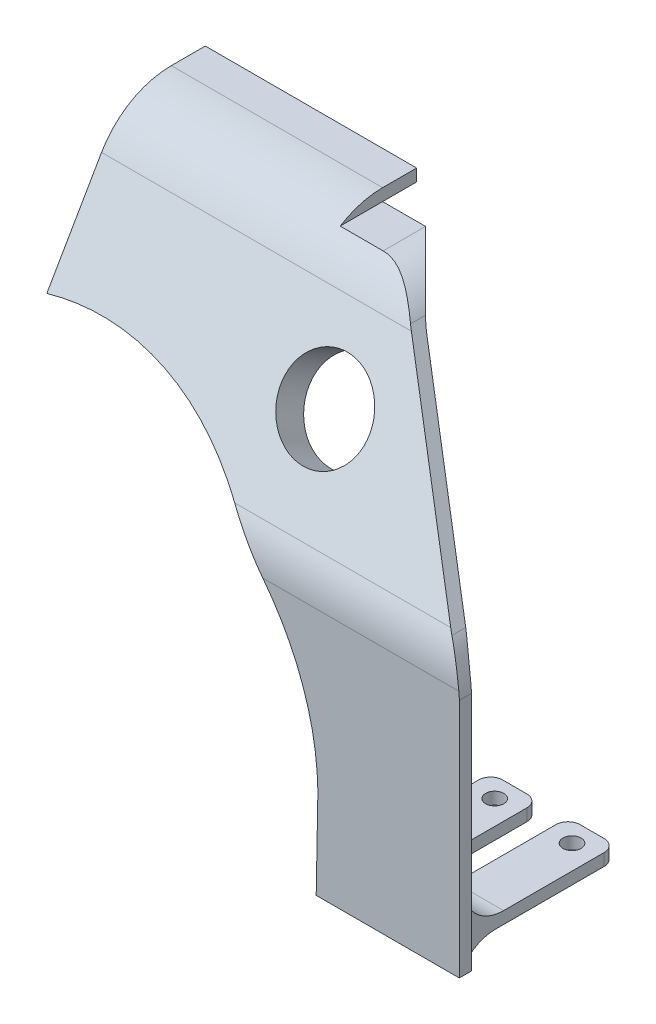
from build123d import *

# Parameters (mm, degrees)
SALIENTE_EXTRUIR1_DEPTH  = 58.05
REDONDEO1_R              = 20
REDONDEO2_R              = 20
REDONDEO3_R              = 17
REDONDEO4_R              = 17
CAVIDAD1_START           = -47
CAVIDAD1_DEPTH           = 51
CROQUIS8_W               = 12
CROQUIS8_H               = 3
SALIENTE_EXTRUIR2_DEPTH  = 38
CROQUIS9_R               = 2.25
CORTAR_EXTRUIR6_DEPTH    = 135.588949923
SALIENTE_EXTRUIR3_REACH  = 146.947
CROQUIS11_W              = 20
CROQUIS11_H              = 3
CROQUIS12_W              = 69.238292886
CROQUIS12_H              = 3
CORTAR_EXTRUIR7_DEPTH    = 1
CROQUIS15_R              = 1.75
CORTAR_EXTRUIR10_DEPTH   = 5
REDONDEO5_R              = 7
REDONDEO6_R              = 3
CROQUIS18_R              = 11
CORTAR_EXTRUIR12_DEPTH   = 146.081609054
CROQUIS19_R              = 13.25
CROQUIS19_R_2            = 11
SALIENTE_EXTRUIR4_DEPTH  = 5
CROQUIS16_R              = 65
CORTAR_EXTRUIR11_DEPTH   = 145.946782753
SALIENTE_EXTRUIR5_DEPTH  = 3
NERVIO8_START            = -1.125
NERVIO8_DEPTH            = 2.25
MATRIZC2_COUNT           = 6
REDONDEO6_OF_SIMETR_A1_R = 3
REDONDEO7_R              = 10
REDONDEO8_R              = 10
REDONDEO9_R              = 6
CORTAR_EXTRUIR14_DEPTH   = 145.946782753
REDONDEO10_R             = 5


with BuildPart() as part:
    # Croquis1 → Saliente-Extruir1 (new, symmetric)
    with BuildSketch(Plane(origin=(0, 0, 0), x_dir=(0, 0, -1), z_dir=(1, 0, 0))):
        Polygon((0, 0), (0, 67.196152423), (28.732050808, 116.961524227), (47, 116.961524227), (47, 119.961524227), (27, 119.961524227), (-3, 68), (-3, 0), align=None)
    extrude(amount=SALIENTE_EXTRUIR1_DEPTH, both=True)

    # Redondeo1
    redondeo1_edges = [part.edges().sort_by_distance(p)[0] for p in [
        (0, 68, 3),
    ]]
    fillet(redondeo1_edges, radius=REDONDEO1_R)

    # Redondeo2
    redondeo2_edges = [part.edges().sort_by_distance(p)[0] for p in [
        (0, 119.961524227, -27),
    ]]
    fillet(redondeo2_edges, radius=REDONDEO2_R)

    # Redondeo3
    redondeo3_edges = [part.edges().sort_by_distance(p)[0] for p in [
        (0, 116.961524227, -28.732050808),
    ]]
    fillet(redondeo3_edges, radius=REDONDEO3_R)

    # Redondeo4
    redondeo4_edges = [part.edges().sort_by_distance(p)[0] for p in [
        (0, 67.196152423, 0),
    ]]
    fillet(redondeo4_edges, radius=REDONDEO4_R)

    # Cavidad1: read off the stored shape, not the designer's step
    # Cavidad1 outline → Cavidad1 (cut)
    with BuildSketch(Plane.XY.offset(CAVIDAD1_START)):
        with BuildLine():
            Line((58.05, 0), (58.05, 119.961524227))
            Line((58.05, 119.961524227), (-5.55, 119.961524227))
            Line((-5.55, 119.961524227), (-5.55, 116.961524227))
            Line((-5.55, 116.961524227), (5.123846837, 116.961524227))
            ThreePointArc((5.123846837, 116.961524227), (12.308357287, 115.368756607), (18.14660237, 110.888913592))
            Line((18.14660237, 110.888913592), (51.073651347, 71.647984679))
            ThreePointArc((51.073651347, 71.647984679), (54.025670368, 66.534937751), (55.050895814, 60.720595315))
            Line((55.050895814, 60.720595315), (55.050895814, 0))
            Line((55.050895814, 0), (58.05, 0))
        make_face()
    extrude(amount=CAVIDAD1_DEPTH, mode=Mode.SUBTRACT)

    # Croquis8 → Saliente-Extruir2 (add)
    with BuildSketch(Plane(origin=(0, 0, 0), x_dir=(-1, 0, 0), z_dir=(0, 0, -1))):
        with Locations((-47.050895814, 6.5)):
            Rectangle(CROQUIS8_W, CROQUIS8_H)
    saliente_extruir2 = extrude(amount=SALIENTE_EXTRUIR2_DEPTH)

    # Croquis9 → Cortar-Extruir6 (cut, through all)
    with BuildSketch(Plane(origin=(0, 8, 0), x_dir=(1, 0, 0), z_dir=(0, 1, 0))):
        with Locations(Location((47.050895814, 33, 0), (0, 0, 180))):
            Circle(CROQUIS9_R)
    cortar_extruir6 = extrude(amount=-CORTAR_EXTRUIR6_DEPTH, mode=Mode.SUBTRACT)

    # Saliente-Extruir3: up to this plane
    saliente_extruir3_end = Plane(origin=(58.05, 67.196152423, 0), z_dir=(0, 0.49999999999999767, 0.86602540378444))
    # Croquis11 → Saliente-Extruir3 (add, up to the surface)
    with BuildSketch(Plane(origin=(0, 0, -54), x_dir=(-1, 0, 0), z_dir=(0, 0, -1)), mode=Mode.PRIVATE) as saliente_extruir3_sk1:
        with Locations((28.05, 92.461524227)):
            Rectangle(CROQUIS11_W, CROQUIS11_H)
    saliente_extruir3_tool1 = split(extrude(saliente_extruir3_sk1.sketch, amount=-SALIENTE_EXTRUIR3_REACH, mode=Mode.PRIVATE), bisect_by=saliente_extruir3_end, keep=Keep.BOTH, mode=Mode.PRIVATE)
    add(saliente_extruir3_tool1.solids().sort_by_distance((-28.05, 92.461524, -54))[0])

    # Croquis12 → Cortar-Extruir7 (cut)
    with BuildSketch(Plane.XZ):
        with Locations((20.431749371, 1.5)):
            Rectangle(CROQUIS12_W, CROQUIS12_H)
    extrude(amount=-CORTAR_EXTRUIR7_DEPTH, mode=Mode.SUBTRACT)

    # Croquis15 → Cortar-Extruir10 (cut)
    with BuildSketch(Plane.XZ.offset(-90.961524227)):
        with Locations(Location((-28.049104186, -49.5, 0), (0, 0, 270))):
            Circle(CROQUIS15_R)
    extrude(amount=-CORTAR_EXTRUIR10_DEPTH, mode=Mode.SUBTRACT)

    # Redondeo5
    redondeo5_edges = [part.edges().sort_by_distance(p)[0] for p in [
        (-18.05, 92.461524227, -54),
        (-38.05, 92.461524227, -54),
    ]]
    fillet(redondeo5_edges, radius=REDONDEO5_R)

    # Redondeo6
    redondeo6_edges = [part.edges().sort_by_distance(p)[0] for p in [
        (53.050895814, 6.5, -38),
        (41.050895814, 6.5, -38),
    ]]
    fillet(redondeo6_edges, radius=REDONDEO6_R)

    # Croquis18 → Cortar-Extruir12 (cut, through all)
    with BuildSketch(Plane(origin=(0, 18.299038106, 31.694863729), x_dir=(1, 0, 0), z_dir=(0, 0.4999999999999976, 0.86602540378444))):
        with Locations(Location((7.567578046, 85.748711306, 0), (0, 0, 270))):
            Circle(CROQUIS18_R)
    extrude(amount=-CORTAR_EXTRUIR12_DEPTH, mode=Mode.SUBTRACT)

    # Croquis19 → Saliente-Extruir4 (add)
    with BuildSketch(Plane(origin=(0, 16.799038106, 29.096787517), x_dir=(-1, 0, 0), z_dir=(0, -0.4999999999999977, -0.8660254037844399))):
        with Locations(Location((-7.567578046, 85.748711306, 0), (0, 0, 270))):
            Circle(CROQUIS19_R)
        with Locations(Location((-7.567578046, 85.748711306, 0), (0, 0, 270))):
            Circle(CROQUIS19_R_2, mode=Mode.SUBTRACT)
    extrude(amount=SALIENTE_EXTRUIR4_DEPTH)

    # Croquis16 → Cortar-Extruir11 (cut, through all)
    with BuildSketch(Plane.XY.offset(3)):
        with Locations((-45.071920691, 22.721524227)):
            Circle(CROQUIS16_R)
    extrude(amount=-CORTAR_EXTRUIR11_DEPTH, mode=Mode.SUBTRACT)

    # Croquis25 → Saliente-Extruir5 (add)
    with BuildSketch(Plane.XZ.offset(-90.961524227)):
        Polygon((-38.05, -13.720943809), (-45.254421175, -13.720943809), (-38.05, -47), align=None)
        Polygon((-10.845578825, -13.720943809), (-18.05, -47), (-18.05, -13.720943809), align=None)
    extrude(amount=-SALIENTE_EXTRUIR5_DEPTH)

    # Nervio8: read off the stored shape, not the designer's step
    # Nervio8 outline → Nervio8 (add)
    with BuildSketch(Plane(origin=(46.658144676, 40.407138583, -23.329072338), x_dir=(-0.707106781186543, 0.6123724356957992, -0.35355339059327456), z_dir=(-0.7071067811865521, -0.6123724356957916, 0.35355339059326985)).offset(NERVIO8_START)):
        Polygon((42.080255309, -28.598076211), (42.032409489, -28.598076211), (34.032409489, -33.598076211), (42.080255309, -33.598076211), align=None)
    nervio8 = extrude(amount=NERVIO8_DEPTH)

    # MatrizC2: Nervio8 ×6 about axis
    matrizc2_axis = Axis((7.567578046, 74.260562333, -42.874355653), (0, -0.49999999999999767, -0.86602540378444))
    for i in range(1, MATRIZC2_COUNT):
        add(nervio8.rotate(matrizc2_axis, i * 360 / MATRIZC2_COUNT))

    # Simetría1: Saliente-Extruir2, Cortar-Extruir6 across plane
    add(saliente_extruir2.mirror(Plane(origin=(37.445895814, 0, 0), x_dir=(0, 0, 1), z_dir=(1, 0, 0))))
    add(cortar_extruir6.mirror(Plane(origin=(37.445895814, 0, 0), x_dir=(0, 0, 1), z_dir=(1, 0, 0))), mode=Mode.SUBTRACT)

    # Redondeo6 of Simetría1
    redondeo6_of_simetr_a1_edges = [part.edges().sort_by_distance(p)[0] for p in [
        (21.840895814, 6.5, -38),
        (33.840895814, 6.5, -38),
    ]]
    fillet(redondeo6_of_simetr_a1_edges, radius=REDONDEO6_OF_SIMETR_A1_R)

    # Redondeo7
    # the kernel refuses this fillet: 10 mm, written as the material it adds along each edge
    with BuildSketch(Plane(origin=(21.050895814, 5, 0), x_dir=(0, -1, 0), z_dir=(1, 0, 0))) as redondeo7_piece_1_section:
        with BuildLine():
            CenterArc((10, 8), REDONDEO7_R, 180, 53.130102354)
            Line((0, 8), (-0.2, 8))
            Line((-0.2, 8), (-0.2, 0))
            Line((-0.2, 0), (0, -0.2))
            ThreePointArc((0, -0.2), (2, -0.2), (3.88, -0.16))
            Line((3.88, -0.16), (4, 0))
        make_face()
    redondeo7_piece_1 = extrude(amount=32, mode=Mode.PRIVATE)
    redondeo7_piece_1 = split(redondeo7_piece_1, bisect_by=Plane(origin=(21.840895814, 5, 0), z_dir=(1, 0, 0)), keep=Keep.TOP, mode=Mode.PRIVATE)
    redondeo7_piece_1 = split(redondeo7_piece_1, bisect_by=Plane(origin=(33.840895814, 5, 0), z_dir=(-1, 0, 0)), keep=Keep.TOP, mode=Mode.PRIVATE)
    add(redondeo7_piece_1)
    with BuildSketch(Plane(origin=(41.050895814, 5, 0), x_dir=(0, -1, 0), z_dir=(1, 0, 0))) as redondeo7_piece_2:
        with BuildLine():
            CenterArc((10, 8), REDONDEO7_R, 180, 53.130102354)
            Line((0, 8), (-0.2, 8))
            Line((-0.2, 8), (-0.2, 0))
            Line((-0.2, 0), (0, -0.2))
            ThreePointArc((0, -0.2), (2, -0.2), (3.88, -0.16))
            Line((3.88, -0.16), (4, 0))
        make_face()
    extrude(amount=12)
    with BuildSketch(Plane(origin=(53.840895814, 5, 0), x_dir=(0, -1, 0), z_dir=(-1, 0, 0))) as redondeo7_piece_3_section:
        with BuildLine():
            CenterArc((10, -8), REDONDEO7_R, 126.869897646, 53.130102354)
            Line((0, -8), (-0.2, -8))
            Line((-0.2, -8), (-0.2, 0))
            Line((-0.2, 0), (0, 0.2))
            ThreePointArc((0, 0.2), (2, 0.2), (3.88, 0.16))
            Line((3.88, 0.16), (4, 0))
        make_face()
    redondeo7_piece_3 = extrude(amount=32, mode=Mode.PRIVATE)
    redondeo7_piece_3 = split(redondeo7_piece_3, bisect_by=Plane(origin=(53.050895814, 5, 0), z_dir=(-1, 0, 0)), keep=Keep.TOP, mode=Mode.PRIVATE)
    redondeo7_piece_3 = split(redondeo7_piece_3, bisect_by=Plane(origin=(41.050895814, 5, 0), z_dir=(1, 0, 0)), keep=Keep.TOP, mode=Mode.PRIVATE)
    add(redondeo7_piece_3)
    with BuildSketch(Plane(origin=(33.840895814, 5, 0), x_dir=(0, -1, 0), z_dir=(-1, 0, 0))) as redondeo7_piece_4:
        with BuildLine():
            CenterArc((10, -8), REDONDEO7_R, 126.869897646, 53.130102354)
            Line((0, -8), (-0.2, -8))
            Line((-0.2, -8), (-0.2, 0))
            Line((-0.2, 0), (0, 0.2))
            ThreePointArc((0, 0.2), (2, 0.2), (3.88, 0.16))
            Line((3.88, 0.16), (4, 0))
        make_face()
    extrude(amount=12)

    # Redondeo8
    redondeo8_edges = [part.edges().sort_by_distance(p)[0] for p in [
        (47.050895814, 8, 0),
        (27.840895814, 8, 0),
    ]]
    fillet(redondeo8_edges, radius=REDONDEO8_R)

    # Redondeo9
    redondeo9_edges = [part.edges().sort_by_distance(p)[0] for p in [
        (-28.05, 93.961524227, -15.452994616),
    ]]
    fillet(redondeo9_edges, radius=REDONDEO9_R)

    # Croquis31 → Cortar-Extruir14 (cut, through all)
    with BuildSketch(Plane.XY.offset(3)):
        with BuildLine():
            Line((16.191244305, 1), (19.497703143, 1))
            Line((19.497703143, 1), (19.844268253, 19.421764692))
            ThreePointArc((19.844268253, 19.421764692), (18.686590065, 10.078253042), (16.191244305, 1))
        make_face()
    extrude(amount=-CORTAR_EXTRUIR14_DEPTH, mode=Mode.SUBTRACT)

    # Redondeo10
    redondeo10_edges = [part.edges().sort_by_distance(p)[0] for p in [
        (-28.05, 90.961524227, -13.720943809),
    ]]
    fillet(redondeo10_edges, radius=REDONDEO10_R)


solid = part.part
